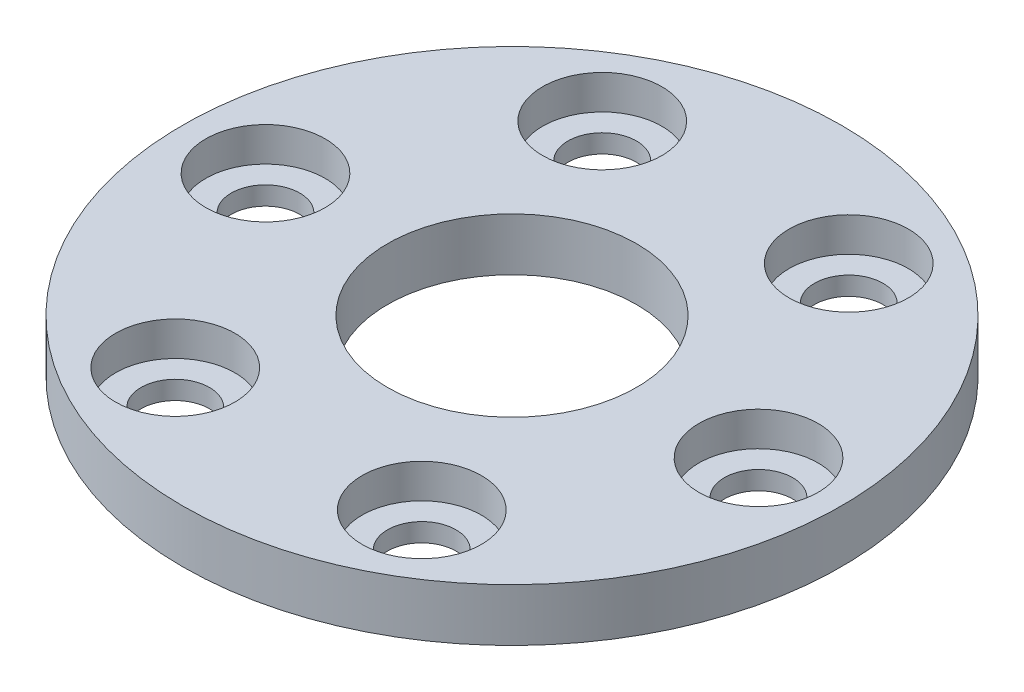
from build123d import *

# Parameters (mm, degrees)
SKETCH1_R                       = 31.75
BOSS_EXTRUDE1_DEPTH             = 5.08
CBORE_FOR_M6_SBHCS1_D           = 6.6
CBORE_FOR_M6_SBHCS1_CBORE_D     = 11.5
CBORE_FOR_M6_SBHCS1_CBORE_DEPTH = 3.3
SKETCH5_R                       = 12
CUT_EXTRUDE1_DEPTH              = 46.187735062


with BuildPart() as part:
    # Sketch1 → Boss-Extrude1 (new body)
    with BuildSketch(Plane(origin=(0, 0, 0), x_dir=(1, 0, 0), z_dir=(0, 1, 0))):
        Circle(SKETCH1_R)
    extrude(amount=BOSS_EXTRUDE1_DEPTH)

    # CBORE for M6 SBHCS1 (through all)
    with Locations(Plane(origin=(0, 5.08, 0), x_dir=(1, 0, 0), z_dir=(0, 1, 0))):
        with Locations((-23.75, 0), (-11.875, 20.56810334), (11.875, 20.56810334), (23.75, 0), (11.875, -20.56810334), (-11.875, -20.56810334)):
            CounterBoreHole(CBORE_FOR_M6_SBHCS1_D / 2, CBORE_FOR_M6_SBHCS1_CBORE_D / 2, CBORE_FOR_M6_SBHCS1_CBORE_DEPTH)

    # Sketch5 → Cut-Extrude1 (cut, through all)
    with BuildSketch(Plane(origin=(0, 5.08, 0), x_dir=(1, 0, 0), z_dir=(0, 1, 0))):
        Circle(SKETCH5_R)
    extrude(amount=-CUT_EXTRUDE1_DEPTH, mode=Mode.SUBTRACT)


solid = part.part
